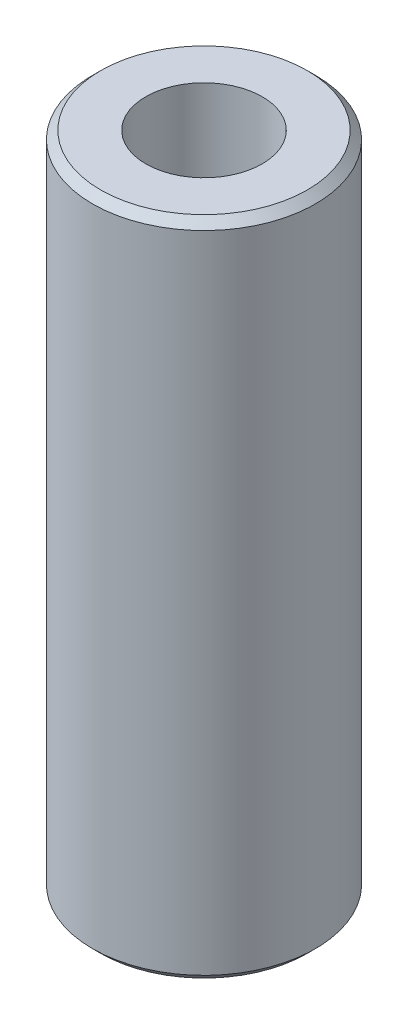
from build123d import *

# Parameters (mm, degrees)
SKETCH1_R           = 57.5
BOSS_EXTRUDE1_DEPTH = 341.138244404
SKETCH2_R           = 30.036886726
CUT_EXTRUDE1_DEPTH  = 351.696167351
CHAMFER1_SIZE       = 4.167712624


with BuildPart() as part:
    # Sketch1 → Boss-Extrude1 (new body)
    with BuildSketch(Plane(origin=(0, 0, 0), x_dir=(1, 0, 0), z_dir=(0, 1, 0))):
        Circle(SKETCH1_R)
    extrude(amount=BOSS_EXTRUDE1_DEPTH)

    # Sketch2 → Cut-Extrude1 (cut, through all)
    with BuildSketch(Plane(origin=(0, 0, 0), x_dir=(1, 0, 0), z_dir=(0, 1, 0))):
        Circle(SKETCH2_R)
    extrude(amount=CUT_EXTRUDE1_DEPTH, mode=Mode.SUBTRACT)

    # Chamfer1
    chamfer1_edges = [part.edges().sort_by_distance(p)[0] for p in [
        (-57.5, 341.138244404, 0),
        (-57.5, 0, 0),
    ]]
    chamfer(chamfer1_edges, length=CHAMFER1_SIZE)


solid = part.part
